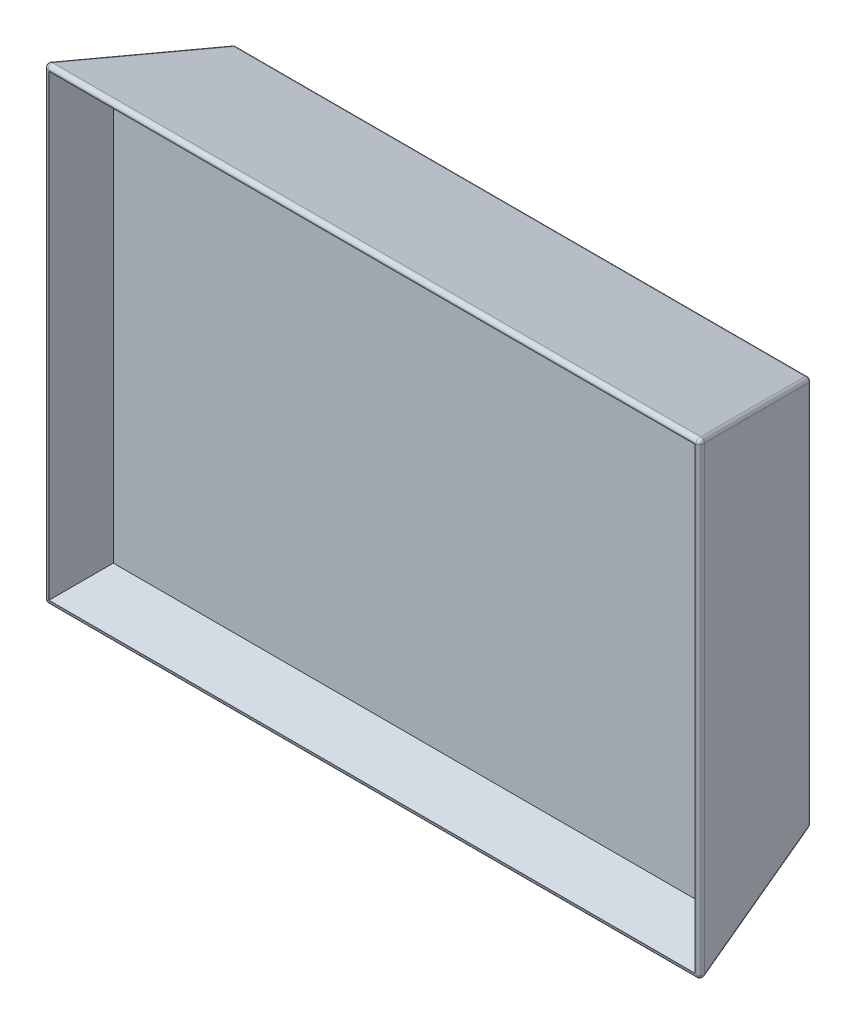
from build123d import *

# Parameters (mm, degrees)
SKETCH_1_W        = 350
SKETCH_1_H        = 250
EXTRUDE_1_DEPTH   = 80
DRAFT_3_ANGLE     = -15
FILLET_1_R        = 2
SHELL_8_OUTLINE_W = 302.524167284
SHELL_8_OUTLINE_H = 202.524167284
SHELL_8_DEPTH     = 77
SHELL_8_DRAFT     = -15
SKETCH_4_W        = 302.524167284
SKETCH_4_H        = 202.524167284
EXTRUDE_3_DEPTH   = 50
EXTRUDE_3_DRAFT   = -15


# Read off the part's stored shape, not the designer's step: 쉘8
with BuildPart() as part:
    # 스케치1 → 보스-돌출1 (new body)
    with BuildSketch(Plane.XY):
        with Locations((175, -125)):
            Rectangle(SKETCH_1_W, SKETCH_1_H)
    extrude(amount=EXTRUDE_1_DEPTH)

    # 구배3
    draft_3_faces = [part.faces().sort_by_distance(p)[0] for p in [
        (350, -125, 40),
        (175, -250, 40),
        (0, -125, 40),
        (175, 0, 40),
    ]]
    draft(draft_3_faces, Plane.XY.offset(80), DRAFT_3_ANGLE)

    # 필렛1
    fillet_1_edges = [part.edges().sort_by_distance(p)[0] for p in [
        (350, -125, 80),
        (175, 0, 80),
        (0, -125, 80),
        (175, -21.435935394, 0),
        (328.564064606, -125, 0),
        (175, -228.564064606, 0),
        (21.435935394, -125, 0),
        (175, -250, 80),
        (10.717967697, -10.717967697, 40),
        (339.282032303, -10.717967697, 40),
        (339.282032303, -239.282032303, 40),
        (10.717967697, -239.282032303, 40),
    ]]
    fillet(fillet_1_edges, radius=FILLET_1_R)


with BuildPart() as shell_8_tool:
    # 쉘8 outline → 쉘8 (with draft: the straight prism first)
    with BuildSketch(Plane.XY.offset(3)):
        with Locations((175, -125)):
            Rectangle(SHELL_8_OUTLINE_W, SHELL_8_OUTLINE_H)
    extrude(amount=SHELL_8_DEPTH)
    # 쉘8: the draft: its side faces are tilted about the plane it starts from
    shell_8_sides = [shell_8_tool.faces().sort_by_distance(p)[0] for p in [
        (175, -226.262083642, 41.5),
        (326.262083642, -125, 41.5),
        (175, -23.737916358, 41.5),
        (23.737916358, -125, 41.5),
    ]]
    draft(shell_8_sides, Plane.XY.offset(3), SHELL_8_DRAFT)


with BuildPart() as part_1:
    add(part.part)

    # 쉘8: cut by shell_8_tool
    add(shell_8_tool.part, mode=Mode.SUBTRACT)


with BuildPart() as body_2:
    # 스케치4 → 보스-돌출3 (with draft: the straight prism first)
    with BuildSketch(Plane.XY.offset(3)):
        with Locations((175, -125)):
            Rectangle(SKETCH_4_W, SKETCH_4_H)
    extrude(amount=EXTRUDE_3_DEPTH)
    # 보스-돌출3: the draft: its side faces are tilted about the plane it starts from
    extrude_3_sides = [body_2.faces().sort_by_distance(p)[0] for p in [
        (326.262083642, -125, 28),
        (175, -23.737916358, 28),
        (23.737916358, -125, 28),
        (175, -226.262083642, 28),
    ]]
    draft(extrude_3_sides, Plane.XY.offset(3), EXTRUDE_3_DRAFT)


solid = Compound([part_1.part, body_2.part])
